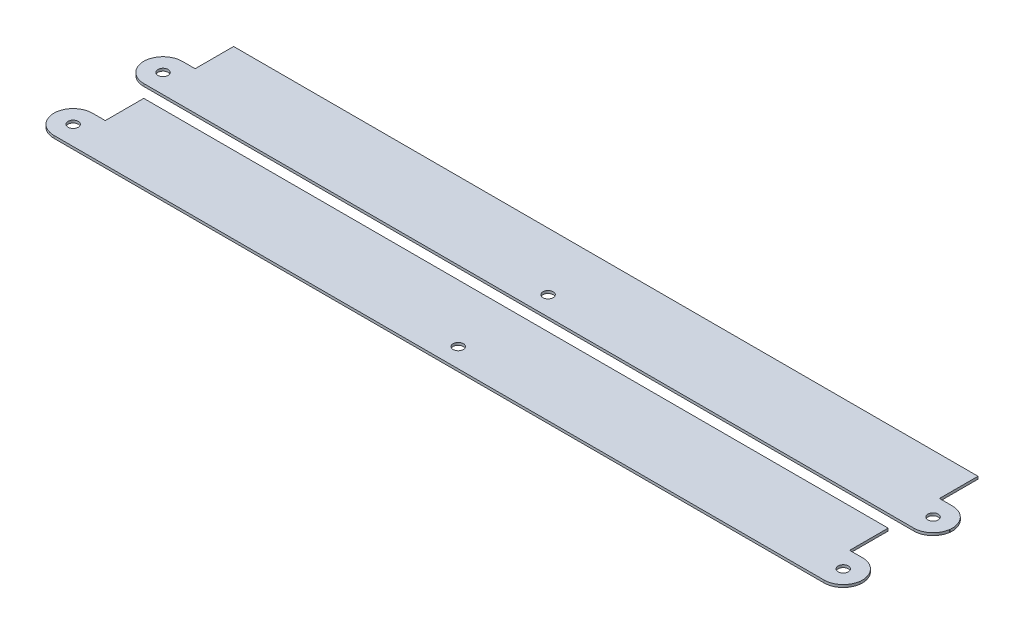
from build123d import *

# Parameters (mm, degrees)
SKETCH1_R           = 2
BOSS_EXTRUDE1_DEPTH = 1
LPATTERN1_COUNT     = 2
LPATTERN1_PITCH     = 35


with BuildPart() as part:
    # Sketch1 → Boss-Extrude1 (new body)
    with BuildSketch(Plane(origin=(0, 0, 0), x_dir=(1, 0, 0), z_dir=(0, 1, 0))):
        with BuildLine():
            Line((5, 7.5), (0, 7.5))
            ThreePointArc((0, 7.5), (-4.937104415, 5.645794895), (-7.433034374, 1))
            Line((-7.433034374, 1), (-7.5, 1))
            Line((-7.5, 1), (-7.5, -1))
            Line((-7.5, -1), (-7.433034374, -1))
            ThreePointArc((-7.433034374, -1), (-4.937104415, -5.645794895), (0, -7.5))
            Line((0, -7.5), (300, -7.5))
            ThreePointArc((300, -7.5), (304.937104415, -5.645794895), (307.433034374, -1))
            Line((307.433034374, -1), (307.5, -1))
            Line((307.5, -1), (307.5, 1))
            Line((307.5, 1), (307.433034374, 1))
            ThreePointArc((307.433034374, 1), (304.937104415, 5.645794895), (300, 7.5))
            Line((300, 7.5), (295, 7.5))
            Line((295, 7.5), (295, 22.5))
            Line((295, 22.5), (5, 22.5))
            Line((5, 22.5), (5, 7.5))
        make_face()
        Circle(SKETCH1_R, mode=Mode.SUBTRACT)
        with Locations((150, 0)):
            Circle(SKETCH1_R, mode=Mode.SUBTRACT)
        with Locations((300, 0)):
            Circle(SKETCH1_R, mode=Mode.SUBTRACT)
    extrude(amount=BOSS_EXTRUDE1_DEPTH)


with BuildPart() as lpattern1_1:
    # LPattern1: pattern copy
    add(part.part.moved(Location(Vector(0, 0, -1) * (1 * LPATTERN1_PITCH))))


solid = Compound([part.part, lpattern1_1.part])
